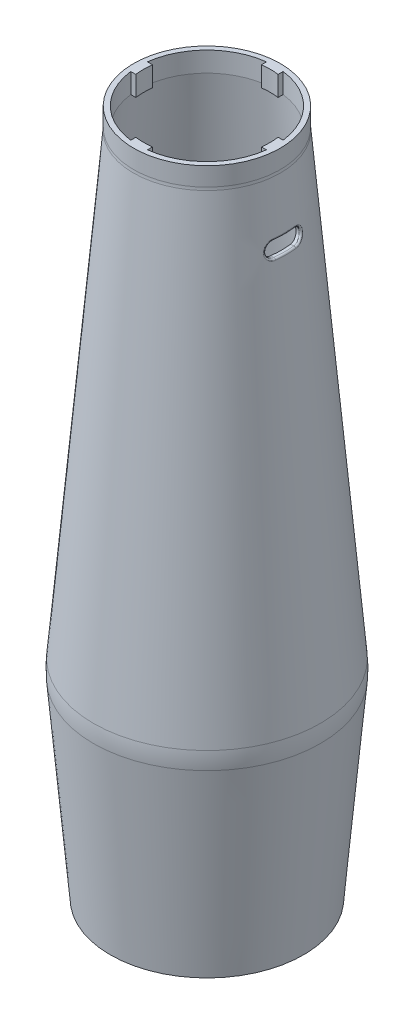
from build123d import *

# Parameters (mm, degrees)
CROQUIS1_R                 = 22
SALIENTE_EXTRUIR1_DEPTH    = 6
REDONDEO1_R                = 30
REDONDEO2_R                = 10
CORTAR_EXTRUIR1_DEPTH      = 20
REDONDEO3_R                = 0.5
SALIENTE_EXTRUIR2_DEPTH    = 2.5
CROQUIS11_W                = 4
CROQUIS11_H                = 4
CROQUIS11_H_2              = 5
CORTAR_EXTRUIR2_DEPTH      = 1.25
S_LIDO_MOVER_COPIAR1_ANGLE = 179.99999999999963


with BuildPart() as part:
    # Croquis1 → Saliente-Extruir1 (new body)
    with BuildSketch(Plane(origin=(0, 0, 0), x_dir=(1, 0, 0), z_dir=(0, 1, 0))):
        with Locations(Location((0, 0, 0), (0, 0, 270))):
            Circle(CROQUIS1_R)
        with BuildLine():
            Line((2.5, -20.346989949375807), (2.4999999999999987, -18.834808201837365))
            ThreePointArc((2.4999999999999987, -18.834808201837365), (1.16e-15, -19.000000000000004), (-2.4999999999999987, -18.834808201837365))
            Line((-2.4999999999999987, -18.834808201837365), (-2.5, -20.346989949375807))
            ThreePointArc((-2.5, -20.346989949375807), (-14.495689014324114, -14.495689014324334), (-20.346989949375768, -2.5000000000003038))
            Line((-20.346989949375768, -2.5000000000003038), (-18.834808201837326, -2.5000000000003038))
            ThreePointArc((-18.834808201837326, -2.5000000000003038), (-18.999999999999996, -1.4955e-13), (-18.83480820183736, 2.499999999999995))
            Line((-18.83480820183736, 2.499999999999995), (-20.346989949375807, 2.4999999999999947))
            ThreePointArc((-20.346989949375807, 2.4999999999999947), (-14.495689014324226, 14.495689014324228), (-2.5, 20.346989949375807))
            Line((-2.5, 20.346989949375807), (-2.4999999999999987, 18.834808201837365))
            ThreePointArc((-2.4999999999999987, 18.834808201837365), (1.16e-15, 19.000000000000004), (2.4999999999999987, 18.834808201837365))
            Line((2.4999999999999987, 18.834808201837365), (2.5, 20.346989949375807))
            ThreePointArc((2.5, 20.346989949375807), (14.495689014324228, 14.495689014324226), (20.346989949375807, 2.4999999999999947))
            Line((20.346989949375807, 2.4999999999999947), (18.83480820183736, 2.499999999999995))
            ThreePointArc((18.83480820183736, 2.499999999999995), (19, -5.27e-15), (18.83480820183736, -2.500000000000005))
            Line((18.83480820183736, -2.500000000000005), (20.346989949375807, -2.5000000000000053))
            ThreePointArc((20.346989949375807, -2.5000000000000053), (14.495689014324226, -14.495689014324228), (2.5, -20.346989949375807))
        make_face(mode=Mode.SUBTRACT)
    extrude(amount=-SALIENTE_EXTRUIR1_DEPTH)

    # Croquis3 → Revolución1 (revolve)
    with BuildSketch(Plane.XY, mode=Mode.PRIVATE) as revoluci_n1_sk:
        Polygon((-22, 0), (-34.24841289362889, 140), (-28.9990930820732, 199.99999999999997), (-27.4990930820732, 200), (-32.74841289362888, 140.00000000000003), (-20.499999999999996, 0), align=None)
    revolve(revoluci_n1_sk.sketch.rotate(Axis((0, 0, 0), (0, 1, 0)), 270), axis=Axis((0, 0, 0), (0, 1, 0)))

    # Redondeo1
    redondeo1_edges = [part.edges().sort_by_distance(p)[0] for p in [
        (-1.18e-14, 140, 34.24841289362889),
    ]]
    fillet(redondeo1_edges, radius=REDONDEO1_R)

    # Redondeo2
    # the kernel refuses this fillet: 10 mm, written as the material it adds along each edge
    with BuildSketch(Plane(origin=(0, 0, 0), x_dir=(3.1e-16, 0, -1), z_dir=(1, 0, 3.1e-16))) as redondeo2_piece_1:
        with BuildLine():
            CenterArc((22 + REDONDEO2_R, -REDONDEO2_R * 0.0436609429085), REDONDEO2_R, 175.0000000000002, 4.999999999999773)
            Line((22, -REDONDEO2_R * 0.0436609429085), (22, 0))
            Line((22, 0), (22 + REDONDEO2_R * 0.00380530190825, REDONDEO2_R * 0.0434947998391))
        make_face()
    revolve(axis=Axis((0, 0, 0), (0, 1, 0)), revolution_arc=180)
    with BuildSketch(Plane(origin=(0, 0, 0), x_dir=(-1.8e-16, 0, 1), z_dir=(-1, 0, -1.8e-16))) as redondeo2_piece_2:
        with BuildLine():
            CenterArc((22 + REDONDEO2_R, -REDONDEO2_R * 0.0436609429085), REDONDEO2_R, 175.0000000000002, 4.999999999999773)
            Line((22, -REDONDEO2_R * 0.0436609429085), (22, 0))
            Line((22, 0), (22 + REDONDEO2_R * 0.00380530190825, REDONDEO2_R * 0.0434947998391))
        make_face()
    revolve(axis=Axis((0, 0, 0), (0, 1, 0)), revolution_arc=180)

    # Croquis5 → Cortar-Extruir1 (cut)
    with BuildSketch(Plane(origin=(21.83288528313431, -1.910129954336161, 3.2e-16), x_dir=(2e-17, 0, -1), z_dir=(0.9961946980917459, -0.08715574274765482, 0))):
        with BuildLine():
            Line((-3, 22.249999999999996), (3, 22.249999999999996))
            ThreePointArc((3, 22.249999999999996), (5.249999999999993, 20), (3, 17.750000000000007))
            Line((3, 17.750000000000007), (-3, 17.750000000000007))
            ThreePointArc((-3, 17.750000000000007), (-5.2499999999999964, 20), (-3, 22.249999999999996))
        make_face()
    extrude(amount=-CORTAR_EXTRUIR1_DEPTH, mode=Mode.SUBTRACT)

    # Redondeo3
    redondeo3_edges = [part.edges().sort_by_distance(p)[0] for p in [
        (22.988635281625058, 18.065166606919497, 5.249999998803285),
        (23.72490212937321, 20.25933140575734, 1.5029838138789866),
        (22.988635281626035, 18.06516660693038, -5.249999998803282),
        (23.331901422726983, 15.776525243401514, -1.5030855168451525),
    ]]
    fillet(redondeo3_edges, radius=REDONDEO3_R)

    # Croquis9 → Saliente-Extruir2 (add, symmetric)
    with BuildSketch(Plane.XY):
        Polygon((-22.687216588148008, 25), (-17.68721658814801, 25), (-17.68721658814801, 30), (-23.124659905777616, 30.000000000000007), align=None)
        Polygon((-26.97416110091812, 74), (-17.68721658814801, 74), (-17.68721658814801, 79), (-27.411604418547725, 79), align=None)
        Polygon((17.68721658814801, 30), (23.124659905777616, 30.000000000000007), (22.687216588148008, 25), (17.68721658814801, 25), align=None)
        Polygon((17.68721658814801, 79), (27.411604418547725, 79), (26.97416110091812, 74), (17.68721658814801, 74), align=None)
    extrude(amount=SALIENTE_EXTRUIR2_DEPTH, both=True)

    # Croquis11 → Cortar-Extruir2 (cut, symmetric)
    with BuildSketch(Plane.XY):
        with Locations((-19.68721658814801, 28.000000000000004)):
            Rectangle(CROQUIS11_W, CROQUIS11_H)
        with Locations((19.68721658814801, 28.000000000000004)):
            Rectangle(CROQUIS11_W, CROQUIS11_H)
        with Locations((-19.68721658814801, 76.5)):
            Rectangle(CROQUIS11_W, CROQUIS11_H_2)
        with Locations((19.68721658814801, 76.5)):
            Rectangle(CROQUIS11_W, CROQUIS11_H_2)
    extrude(amount=CORTAR_EXTRUIR2_DEPTH, both=True, mode=Mode.SUBTRACT)


with BuildPart() as part_1:
    # Sólido-Mover/Copiar1: moved
    add(part.part.rotate(Axis((0, 97, 6.6769e-13), (1, 0, 0)), S_LIDO_MOVER_COPIAR1_ANGLE))


solid = part_1.part
